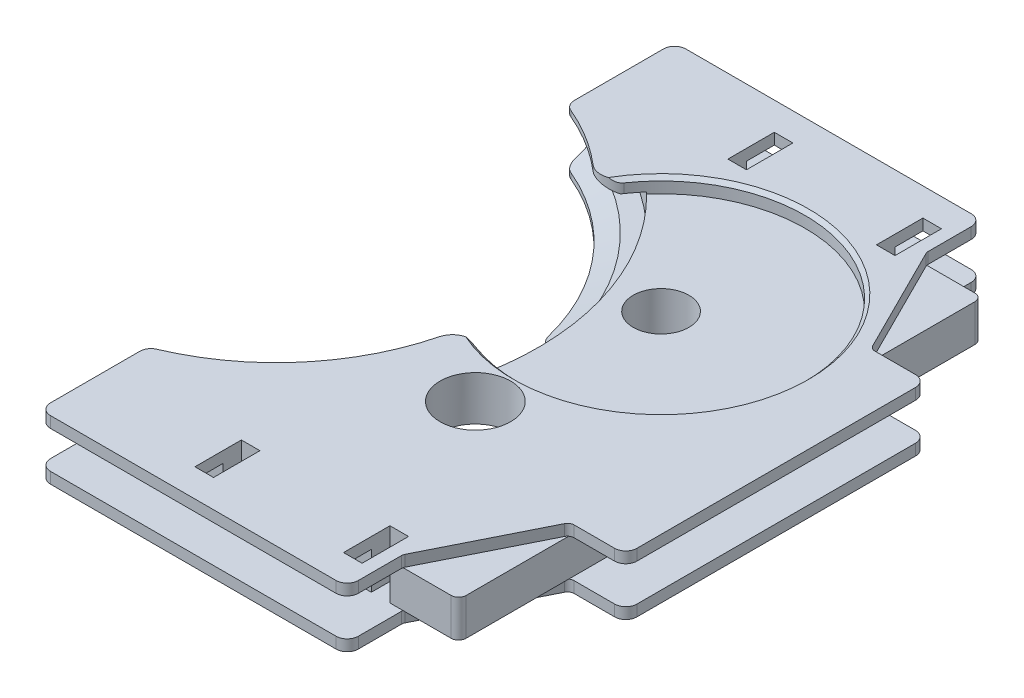
from build123d import *

# Parameters (mm, degrees)
EXTRUDE_1_DEPTH     = 4.5
FILLET_START        = -5
FILLET_1_DEPTH      = 10
EXTRUDE_2_DEPTH     = 0.5
EXTRUDE_3_DEPTH     = 3
CHAMFER_1_SIZE      = 5
CHAMFER_1_SIZE_2    = 2
CHAMFER_2_SIZE      = 5
CHAMFER_2_SIZE_2    = 2
FILLET_3_R          = 3
FILLET_4_R          = 3
SKETCH_5_R          = 7.5
SKETCH_5_R_2        = 9.5
CUT_EXTRUDE_1_DEPTH = 30
SKETCH_6_R          = 38.75
CUT_EXTRUDE_2_DEPTH = 4
CHAMFER_3_SIZE      = 1
SKETCH_7_R          = 38.75
CUT_EXTRUDE_3_DEPTH = 4
CHAMFER_4_SIZE      = 1
FILLET_5_R          = 5
CUT_EXTRUDE_START   = -3
SKETCH_9_W          = 5
SKETCH_9_H          = 12.5
CUT_EXTRUDE_4_DEPTH = 3
SKETCH_10_W         = 5
SKETCH_10_H         = 5.010674462
CUT_EXTRUDE_5_DEPTH = 10


with BuildPart() as part:
    # ｽｹｯﾁ2 → ﾎﾞｽ - 押し出し1 (new, symmetric)
    with BuildSketch(Plane(origin=(0, 0, 0), x_dir=(1, 0, 0), z_dir=(0, 1, 0))):
        with BuildLine():
            Line((95.1, 70.5), (-24.5, 70.5))
            ThreePointArc((-24.5, 70.5), (25.351028074, 49.851028074), (46, 0))
            ThreePointArc((46, 0), (25.351028074, -49.851028074), (-24.5, -70.5))
            Line((-24.5, -70.5), (95.1, -70.5))
            Line((95.1, -70.5), (95.1, 70.5))
        make_face()
    extrude(amount=EXTRUDE_1_DEPTH, both=True)

    # ﾌｨﾚｯﾄ1: read off the stored shape, not the designer's step
    # ﾌｨﾚｯﾄ1 outline → ﾌｨﾚｯﾄ1 (cut)
    with BuildSketch(Plane(origin=(0, 0, 0), x_dir=(1, 0, 0), z_dir=(0, 1, 0)).offset(FILLET_START)):
        with BuildLine():
            Line((95.1, 70.5), (93.1, 70.5))
            ThreePointArc((93.1, 70.5), (94.514213562, 69.914213562), (95.1, 68.5))
            Line((95.1, 68.5), (95.1, 70.5))
        make_face()
        with BuildLine():
            ThreePointArc((-1.406451941, 66.610344828), (-2.723536699, 68.83218192), (-0.751315826, 70.5))
            Line((-0.751315826, 70.5), (-24.5, 70.5))
            ThreePointArc((-24.5, 70.5), (-12.790587341, 69.520785778), (-1.406451941, 66.610344828))
        make_face()
        with BuildLine():
            Line((95.1, -70.5), (95.1, -68.5))
            ThreePointArc((95.1, -68.5), (94.514213562, -69.914213562), (93.1, -70.5))
            Line((93.1, -70.5), (95.1, -70.5))
        make_face()
        with BuildLine():
            ThreePointArc((-0.751315826, -70.5), (-2.723536699, -68.83218192), (-1.406451941, -66.610344828))
            ThreePointArc((-1.406451941, -66.610344828), (-12.790587341, -69.520785778), (-24.5, -70.5))
            Line((-24.5, -70.5), (-0.751315826, -70.5))
        make_face()
    extrude(amount=FILLET_1_DEPTH, mode=Mode.SUBTRACT)

    # ｽｹｯﾁ3 → ﾎﾞｽ - 押し出し2 (add)
    with BuildSketch(Plane(origin=(0, 4.5, 0), x_dir=(1, 0, 0), z_dir=(0, 1, 0))):
        with BuildLine():
            Line((-2.751315826, -56.455688258), (-2.751315826, -68.5))
            ThreePointArc((-2.751315826, -68.5), (-2.165529388, -69.914213562), (-0.751315826, -70.5))
            Line((-0.751315826, -70.5), (93.1, -70.5))
            ThreePointArc((93.1, -70.5), (94.514213562, -69.914213562), (95.1, -68.5))
            Line((95.1, -68.5), (95.1, 68.5))
            ThreePointArc((95.1, 68.5), (94.514213562, 69.914213562), (93.1, 70.5))
            Line((93.1, 70.5), (-0.751315826, 70.5))
            ThreePointArc((-0.751315826, 70.5), (-2.165529388, 69.914213562), (-2.751315826, 68.5))
            Line((-2.751315826, 68.5), (-2.751315826, 56.455688258))
            ThreePointArc((-2.751315826, 56.455688258), (36, 0), (-2.751315826, -56.455688258))
        make_face()
    extrude_2 = extrude(amount=EXTRUDE_2_DEPTH)

    # ｽｹｯﾁ4 → ﾎﾞｽ - 押し出し3 (add)
    with BuildSketch(Plane(origin=(0, 5, 0), x_dir=(1, 0, 0), z_dir=(0, 1, 0))):
        with BuildLine():
            Line((80.1, 85.5), (-2.751315826, 85.5))
            Line((-2.751315826, 85.5), (-2.751315826, 56.455688258))
            ThreePointArc((-2.751315826, 56.455688258), (36, 0), (-2.751315826, -56.455688258))
            Line((-2.751315826, -56.455688258), (-2.751315826, -85.5))
            Line((-2.751315826, -85.5), (80.1, -85.5))
            Line((80.1, -85.5), (80.1, -70.913118961))
            ThreePointArc((80.1, -70.913118961), (80.146814268, -70.51105135), (80.284752416, -70.130495168))
            Line((80.284752416, -70.130495168), (94.616311896, -41.467376208))
            ThreePointArc((94.616311896, -41.467376208), (95.261530034, -40.761361085), (96.18155948, -40.5))
            Line((96.18155948, -40.5), (110.1, -40.5))
            Line((110.1, -40.5), (110.1, 40.5))
            Line((110.1, 40.5), (96.18155948, 40.5))
            ThreePointArc((96.18155948, 40.5), (95.261530034, 40.761361085), (94.616311896, 41.467376208))
            Line((94.616311896, 41.467376208), (80.284752416, 70.130495168))
            ThreePointArc((80.284752416, 70.130495168), (80.146814268, 70.51105135), (80.1, 70.913118961))
            Line((80.1, 70.913118961), (80.1, 85.5))
        make_face()
    extrude_3 = extrude(amount=EXTRUDE_3_DEPTH)

    # ﾐﾗｰ1: ﾎﾞｽ - 押し出し2, ﾎﾞｽ - 押し出し3 across plane
    add(extrude_2.mirror(Plane.ZX))
    add(extrude_3.mirror(Plane.ZX))

    # 面取り1
    # the kernel refuses this chamfer: 5, 2 mm, written as the material it takes off along each edge
    with BuildSketch(Plane(origin=(-24.5, 4.5, 0), x_dir=(0.15260552545264225, 0, -0.9882871817449232), z_dir=(-0.9882871817449232, 0, -0.15260552545264225))) as chamfer_1_piece_1:
        Polygon((60.5 + CHAMFER_1_SIZE, 0), (60.5, -CHAMFER_1_SIZE_2), (60.5, 0), align=None)
    revolve(axis=Axis((-24.5, 4.5, 0), (0, -1, 0)), revolution_arc=162.444098221, mode=Mode.SUBTRACT)

    # 面取り2
    # the kernel refuses this chamfer: 5, 2 mm, written as the material it takes off along each edge
    with BuildSketch(Plane(origin=(-24.5, -4.5, 0), x_dir=(0.15260552545264225, 0, -0.9882871817449232), z_dir=(-0.9882871817449232, 0, -0.15260552545264225))) as chamfer_2_piece_1:
        Polygon((60.5 + CHAMFER_2_SIZE, 0), (60.5, CHAMFER_2_SIZE_2), (60.5, 0), align=None)
    revolve(axis=Axis((-24.5, -4.5, 0), (0, -1, 0)), revolution_arc=162.444098221, mode=Mode.SUBTRACT)

    # ﾌｨﾚｯﾄ3
    fillet_3_edges = [part.edges().sort_by_distance(p)[0] for p in [
        (110.1, 6.5, -40.5),
        (110.1, 6.5, 40.5),
        (80.1, 6.5, 85.5),
        (-2.751315826, 6.5, 85.5),
        (-2.751315826, 7.25, -56.455688258),
        (-2.751315826, 7.25, 56.455688258),
        (80.1, 6.5, -85.5),
        (-2.751315826, 6.5, -85.5),
    ]]
    fillet(fillet_3_edges, radius=FILLET_3_R)

    # ﾌｨﾚｯﾄ4
    fillet_4_edges = [part.edges().sort_by_distance(p)[0] for p in [
        (-2.751315826, -7.25, 56.455688258),
        (-2.751315826, -7.25, -56.455688258),
        (110.1, -6.5, -40.5),
        (110.1, -6.5, 40.5),
        (80.1, -6.5, 85.5),
        (-2.751315826, -6.5, 85.5),
        (-2.751315826, -6.5, -85.5),
        (80.1, -6.5, -85.5),
    ]]
    fillet(fillet_4_edges, radius=FILLET_4_R)

    # ｽｹｯﾁ5 → ｶｯﾄ - 押し出し1 (cut)
    with BuildSketch(Plane(origin=(0, 8, 0), x_dir=(1, 0, 0), z_dir=(0, 1, 0))):
        with Locations(Location((54.1, 25, 0), (0, 0, 270))):
            Circle(SKETCH_5_R)
        with Locations(Location((54.1, -25, 0), (0, 0, 270))):
            Circle(SKETCH_5_R_2)
    extrude(amount=-CUT_EXTRUDE_1_DEPTH, mode=Mode.SUBTRACT)

    # ｽｹｯﾁ6 → ｶｯﾄ - 押し出し2 (cut)
    with BuildSketch(Plane(origin=(0, 8, 0), x_dir=(1, 0, 0), z_dir=(0, 1, 0))):
        with Locations((54.1, 25)):
            Circle(SKETCH_6_R)
    extrude(amount=-CUT_EXTRUDE_2_DEPTH, mode=Mode.SUBTRACT)

    # 面取り3
    chamfer_3_edges = [part.edges().sort_by_distance(p)[0] for p in [
        (91.027107796, 8, -36.745263294),
    ]]
    chamfer(chamfer_3_edges, length=CHAMFER_3_SIZE)

    # ｽｹｯﾁ7 → ｶｯﾄ - 押し出し3 (cut)
    with BuildSketch(Plane.XZ.offset(8)):
        with Locations((54.1, 25)):
            Circle(SKETCH_7_R)
    extrude(amount=-CUT_EXTRUDE_3_DEPTH, mode=Mode.SUBTRACT)

    # 面取り4
    chamfer_4_edges = [part.edges().sort_by_distance(p)[0] for p in [
        (91.027107796, -8, 36.745263294),
    ]]
    chamfer(chamfer_4_edges, length=CHAMFER_4_SIZE)

    # ﾌｨﾚｯﾄ5
    # the kernel refuses this fillet: 5 mm, written as the material it takes off along each edge
    with BuildSketch(Plane(origin=(35.340814026, 22.117083115, 8.906569299), x_dir=(0.9094383285266434, 0, 0.4158388228709113), z_dir=(0, -1, 0))) as fillet_5_piece_1:
        with BuildLine():
            CenterArc((6.303329727, 4.985384713), FILLET_5_R, 169.62243813, 95.995664977)
            ThreePointArc((1.385119276, 5.886054442), (0.766142777, 2.925711475), (0, 0))
            ThreePointArc((0, 0), (2.960654872, 0.113268478), (5.921309743, 0))
        make_face()
    extrude(amount=30.734166229, mode=Mode.SUBTRACT)
    with BuildSketch(Plane(origin=(19.200217157, 22.117083115, -41.839467258), x_dir=(0.50210909470181, 0, -0.8648042882743638), z_dir=(0, -1, 0))) as fillet_5_piece_2_section:
        with BuildLine():
            CenterArc((6.303329727, -4.985384713), FILLET_5_R, 94.381896893, 95.995664977)
            ThreePointArc((1.385119276, -5.886054442), (0.766142777, -2.925711475), (0, 0))
            ThreePointArc((0, 0), (2.960654872, -0.113268478), (5.921309743, 0))
        make_face()
    fillet_5_piece_2 = extrude(amount=30.734166229, mode=Mode.PRIVATE)
    fillet_5_piece_2 = split(fillet_5_piece_2, bisect_by=Plane(origin=(19.200217157, 4.5, -41.839467258), z_dir=(0, 1, 0)), keep=Keep.TOP, mode=Mode.PRIVATE)
    add(fillet_5_piece_2, mode=Mode.SUBTRACT)
    with BuildSketch(Plane(origin=(19.200217157, -22.117083115, 41.839467258), x_dir=(-0.7267943331681591, 0, 0.6868551501405888), z_dir=(0, 1, 0))) as fillet_5_piece_3_section:
        with BuildLine():
            CenterArc((6.296702388, 4.993752638), FILLET_5_R, 171.139852436, 95.995664977)
            ThreePointArc((1.356366206, 5.763868475), (0.788439893, 2.855988367), (0, 0))
            ThreePointArc((0, 0), (3.023416623, 0.075593078), (6.046833246, 0))
        make_face()
    fillet_5_piece_3 = extrude(amount=30.734166229, mode=Mode.PRIVATE)
    fillet_5_piece_3 = split(fillet_5_piece_3, bisect_by=Plane(origin=(19.200217157, 4.5, 41.839467258), z_dir=(0, -1, 0)), keep=Keep.TOP, mode=Mode.PRIVATE)
    add(fillet_5_piece_3, mode=Mode.SUBTRACT)
    with BuildSketch(Plane(origin=(35.340814026, -22.117083115, -8.906569299), x_dir=(-0.19646141095301647, 0, -0.9805115573038138), z_dir=(0, 1, 0))) as fillet_5_piece_4:
        with BuildLine():
            CenterArc((6.296702388, -4.993752638), FILLET_5_R, 92.864482588, 95.995664977)
            ThreePointArc((1.356366206, -5.763868475), (0.788439893, -2.855988367), (0, 0))
            ThreePointArc((0, 0), (3.023416623, -0.075593078), (6.046833246, 0))
        make_face()
    extrude(amount=30.734166229, mode=Mode.SUBTRACT)

    # ｽｹｯﾁ9 → ｶｯﾄ - 押し出し4 (cut)
    with BuildSketch(Plane(origin=(0, 8, 0), x_dir=(1, 0, 0), z_dir=(0, 1, 0)).offset(CUT_EXTRUDE_START)):
        with Locations((34.098684174, 71.739325538)):
            Rectangle(SKETCH_9_W, SKETCH_9_H)
        with Locations((74.098684174, 71.739325538)):
            Rectangle(SKETCH_9_W, SKETCH_9_H)
    cut_extrude_4 = extrude(amount=CUT_EXTRUDE_4_DEPTH, mode=Mode.SUBTRACT)

    # ｽｹｯﾁ10 → ｶｯﾄ - 押し出し5 (cut)
    with BuildSketch(Plane(origin=(0, 5, 0), x_dir=(1, 0, 0), z_dir=(0, 1, 0))):
        with Locations((34.098684174, 67.994662769)):
            Rectangle(SKETCH_10_W, SKETCH_10_H)
        with Locations((74.098684174, 67.994662769)):
            Rectangle(SKETCH_10_W, SKETCH_10_H)
    cut_extrude_5 = extrude(amount=-CUT_EXTRUDE_5_DEPTH, mode=Mode.SUBTRACT)

    # ﾐﾗｰ2: ｶｯﾄ - 押し出し4, ｶｯﾄ - 押し出し5 across plane
    add(cut_extrude_4.mirror(Plane.XY), mode=Mode.SUBTRACT)
    add(cut_extrude_5.mirror(Plane.XY), mode=Mode.SUBTRACT)


solid = part.part
